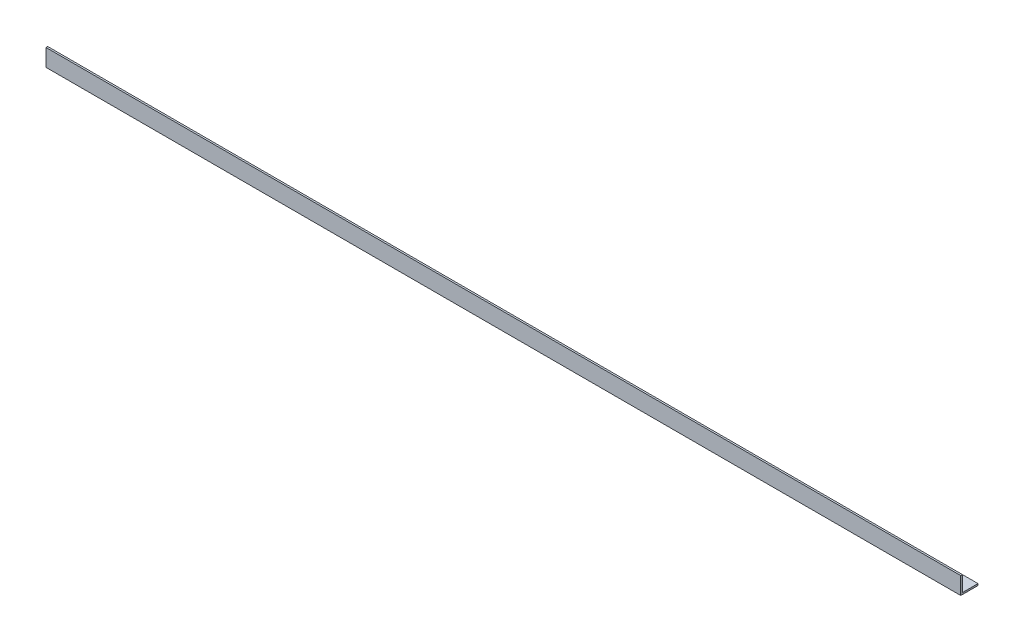
from build123d import *

# Parameters (mm, degrees)
EXTRUDE_1_DEPTH = 2650


with BuildPart() as part:
    # Эскиз1 → Вытянуть-Тонкостенный1 (new body)
    with BuildSketch(Plane(origin=(0, 0, 0), x_dir=(0, 0, -1), z_dir=(1, 0, 0))):
        Polygon((0, 50), (0, 0), (50, 0), (50, 5), (5, 5), (5, 50), align=None)
    extrude(amount=EXTRUDE_1_DEPTH)


solid = part.part
